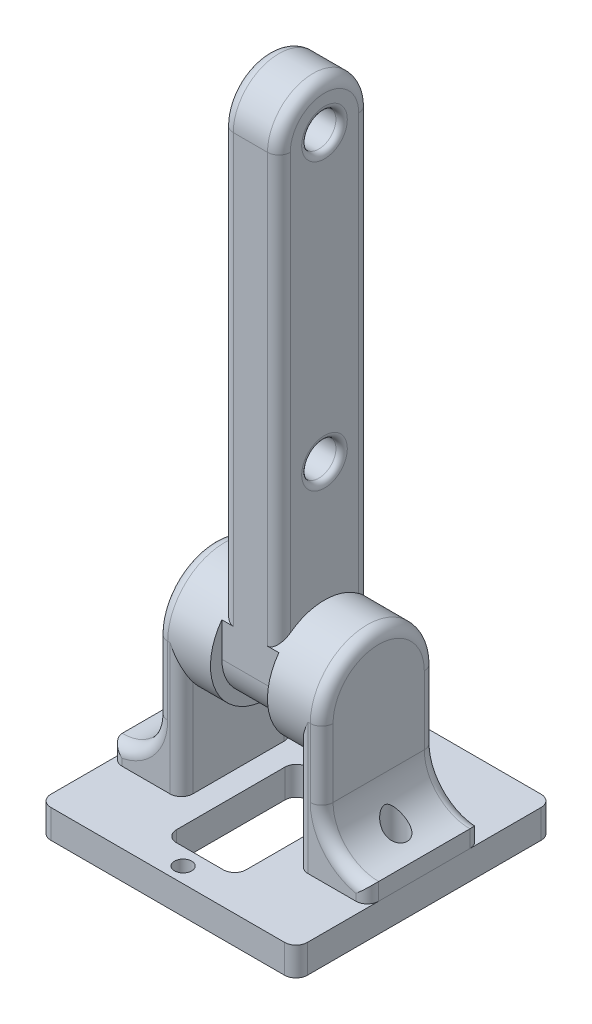
from build123d import *

# Parameters (mm, degrees)
CROQUIS1_W              = 45
CROQUIS1_H              = 45
CROQUIS1_R              = 2
CROQUIS1_R_2            = 1.5
CROQUIS1_W_2            = 12.2
CROQUIS1_H_2            = 23
SALIENTE_EXTRUIR1_DEPTH = 5
CORTAR_EXTRUIR1_START   = -2
CROQUIS2_R              = 2
CROQUIS2_R_2            = 1.5
CORTAR_EXTRUIR1_DEPTH   = 2
CROQUIS3_R              = 3
SALIENTE_EXTRUIR2_DEPTH = 5
SALIENTE_EXTRUIR4_DEPTH = 20
CORTAR_EXTRUIR2_START   = 10
CROQUIS4_R              = 2
CORTAR_EXTRUIR2_DEPTH   = 10
CROQUIS6_R              = 10
SALIENTE_EXTRUIR5_DEPTH = 9.5
REDONDEO3_R             = 2
REDONDEO4_R             = 1
REDONDEO5_R             = 2


with BuildPart() as part:
    # Croquis1 → Saliente-Extruir1 (new body)
    with BuildSketch(Plane(origin=(0, 0, 0), x_dir=(1, 0, 0), z_dir=(0, 1, 0))):
        with Locations((0, 5.35)):
            Rectangle(CROQUIS1_W, CROQUIS1_H)
        with Locations(Location((-17.5, 5.35, 0), (0, 0, 270))):
            Circle(CROQUIS1_R, mode=Mode.SUBTRACT)
        with Locations(Location((17.5, 5.35, 0), (0, 0, 270))):
            Circle(CROQUIS1_R, mode=Mode.SUBTRACT)
        with Locations(Location((0, 14.45, 0), (0, 0, 270))):
            Circle(CROQUIS1_R_2, mode=Mode.SUBTRACT)
        with Locations(Location((0, -14.45, 0), (0, 0, 270))):
            Circle(CROQUIS1_R_2, mode=Mode.SUBTRACT)
        Rectangle(CROQUIS1_W_2, CROQUIS1_H_2, mode=Mode.SUBTRACT)
    extrude(amount=-SALIENTE_EXTRUIR1_DEPTH)

    # Croquis2 → Cortar-Extruir1 (cut)
    # profile 1 of 2: a face of its own
    with BuildSketch(Plane.XZ.offset(5).offset(CORTAR_EXTRUIR1_START)):
        with Locations(Location((0, -14.45, 0), (0, 0, 270))):
            Circle(CROQUIS2_R)
        with Locations(Location((0, -14.45, 0), (0, 0, 90))):
            Circle(CROQUIS2_R_2, mode=Mode.SUBTRACT)
    # profile 2 of 2: a face of its own
    with BuildSketch(Plane.XZ.offset(5).offset(CORTAR_EXTRUIR1_START)):
        with Locations(Location((0, 14.45, 0), (0, 0, 270))):
            Circle(CROQUIS2_R)
        with Locations(Location((0, 14.45, 0), (0, 0, 90))):
            Circle(CROQUIS2_R_2, mode=Mode.SUBTRACT)
    extrude(amount=CORTAR_EXTRUIR1_DEPTH, mode=Mode.SUBTRACT)

    # Redondeo3
    redondeo3_edges = [part.edges().sort_by_distance(p)[0] for p in [
        (-22.5, -2.5, 17.15),
        (-22.5, -2.5, -27.85),
        (22.5, -2.5, -27.85),
        (22.5, -2.5, 17.15),
        (6.1, -2.5, -11.5),
        (-6.1, -2.5, -11.5),
        (-6.1, -2.5, 11.5),
        (6.1, -2.5, 11.5),
    ]]
    fillet(redondeo3_edges, radius=REDONDEO3_R)


with BuildPart() as body_2:
    # Croquis3 → Saliente-Extruir2 (new, symmetric)
    with BuildSketch(Plane(origin=(0, 0, 0), x_dir=(0, 0, -1), z_dir=(1, 0, 0))):
        with BuildLine():
            Line((-2.65, 104), (-2.65, 23))
            ThreePointArc((-2.65, 23), (5.35, 15), (13.35, 23))
            Line((13.35, 23), (13.35, 104))
            ThreePointArc((13.35, 104), (5.35, 112), (-2.65, 104))
        make_face()
        with Locations((5.35, 54)):
            Circle(CROQUIS3_R, mode=Mode.SUBTRACT)
        with Locations((5.35, 104)):
            Circle(CROQUIS3_R, mode=Mode.SUBTRACT)
    extrude(amount=SALIENTE_EXTRUIR2_DEPTH, both=True)

    # Redondeo4
    redondeo4_edges = [body_2.edges().sort_by_distance(p)[0] for p in [
        (5, 104, -2.35),
        (5, 54, -2.35),
        (-5, 54, -2.35),
        (-5, 104, -2.35),
    ]]
    fillet(redondeo4_edges, radius=REDONDEO4_R)


with BuildPart() as body_3:
    # Croquis5 → Saliente-Extruir4 (new body)
    with BuildSketch(Plane.XY.offset(4.65)):
        with BuildLine():
            Line((10.1, 23), (10.1, 0))
            Line((10.1, 0), (22.5, 0))
            Line((22.5, 0), (22.5, 3))
            ThreePointArc((22.5, 3), (16.843145751, 5.343145751), (14.5, 11))
            Line((14.5, 11), (14.5, 23))
            Line((14.5, 23), (10.1, 23))
        make_face()
    extrude(amount=-SALIENTE_EXTRUIR4_DEPTH)

    # Croquis4 → Cortar-Extruir2 (cut)
    with BuildSketch(Plane(origin=(0, 0, 0), x_dir=(1, 0, 0), z_dir=(0, 1, 0)).offset(CORTAR_EXTRUIR2_START)):
        with Locations(Location((17.5, 5.35, 0), (0, 0, 270))):
            Circle(CROQUIS4_R)
    extrude(amount=-CORTAR_EXTRUIR2_DEPTH, mode=Mode.SUBTRACT)

    # Croquis6 → Saliente-Extruir5 (add)
    with BuildSketch(Plane(origin=(14.5, 0, 0), x_dir=(0, 0, -1), z_dir=(1, 0, 0))):
        with Locations((5.35, 23)):
            Circle(CROQUIS6_R)
    extrude(amount=-SALIENTE_EXTRUIR5_DEPTH)


with BuildPart() as body_4:
    # Simetría3: mirrored copy
    add(body_3.part.mirror(Plane(origin=(0, 0, 0), x_dir=(0, 0, 1), z_dir=(1, 0, 0))))


with BuildPart() as body_2_1:
    add(body_2.part)

    # Combinar2: union body 4, body 3
    add(body_4.part)
    add(body_3.part)

    # Redondeo5
    # the kernel refuses this fillet: 2 mm, written as the material it takes off along each edge
    with BuildSketch(Plane(origin=(-5, 104, 2.65), x_dir=(1, 0, 0), z_dir=(0, -1, 0))) as redondeo5_piece_1_section:
        with BuildLine():
            CenterArc((REDONDEO5_R, -REDONDEO5_R), REDONDEO5_R, 90, 90)
            Line((0, -REDONDEO5_R), (0, 0))
            Line((0, 0), (REDONDEO5_R, 0))
        make_face()
    redondeo5_piece_1 = extrude(amount=80, mode=Mode.PRIVATE)
    redondeo5_piece_1 = redondeo5_piece_1 - Plane(origin=(-4.548383472, 23, -5.35), x_dir=(0, 0, -1), z_dir=(-1, 0, 0)) * Cylinder(10, 168, mode=Mode.PRIVATE)
    add(redondeo5_piece_1, mode=Mode.SUBTRACT)
    with BuildSketch(Plane(origin=(-5, 104, -5.35), x_dir=(0, 0, -1), z_dir=(0, -1, 0))) as redondeo5_piece_2:
        with BuildLine():
            CenterArc((8 - REDONDEO5_R, REDONDEO5_R), REDONDEO5_R, 270, 90)
            Line((8 - REDONDEO5_R, 0), (8, 0))
            Line((8, 0), (8, REDONDEO5_R))
        make_face()
    revolve(axis=Axis((-5, 104, -5.35), (1, 0, 0)), revolution_arc=180, mode=Mode.SUBTRACT)
    with BuildSketch(Plane(origin=(-5, 24, -13.35), x_dir=(1, 0, 0), z_dir=(0, 1, 0))) as redondeo5_piece_3_section:
        with BuildLine():
            CenterArc((REDONDEO5_R, -REDONDEO5_R), REDONDEO5_R, 90, 90)
            Line((0, -REDONDEO5_R), (0, 0))
            Line((0, 0), (REDONDEO5_R, 0))
        make_face()
    redondeo5_piece_3 = extrude(amount=80, mode=Mode.PRIVATE)
    redondeo5_piece_3 = redondeo5_piece_3 - Plane(origin=(-4.548386177, 23, -5.35), x_dir=(0, 0, -1), z_dir=(-1, 0, 0)) * Cylinder(10, 169, mode=Mode.PRIVATE)
    add(redondeo5_piece_3, mode=Mode.SUBTRACT)
    with BuildSketch(Plane(origin=(5, 104, -5.35), x_dir=(0, 0, -1), z_dir=(0, -1, 0))) as redondeo5_piece_4:
        with BuildLine():
            CenterArc((8 - REDONDEO5_R, -REDONDEO5_R), REDONDEO5_R, 0, 90)
            Line((8, -REDONDEO5_R), (8, 0))
            Line((8, 0), (8 - REDONDEO5_R, 0))
        make_face()
    revolve(axis=Axis((5, 104, -5.35), (1, 0, 0)), revolution_arc=180, mode=Mode.SUBTRACT)
    with BuildSketch(Plane(origin=(5, 104, 2.65), x_dir=(0, 0, -1), z_dir=(0, -1, 0))) as redondeo5_piece_5_section:
        with BuildLine():
            CenterArc((REDONDEO5_R, -REDONDEO5_R), REDONDEO5_R, 90, 90)
            Line((0, -REDONDEO5_R), (0, 0))
            Line((0, 0), (REDONDEO5_R, 0))
        make_face()
    redondeo5_piece_5 = extrude(amount=80, mode=Mode.PRIVATE)
    redondeo5_piece_5 = redondeo5_piece_5 - Plane(origin=(4.66275863, 23, -5.35), x_dir=(0, 0, -1), z_dir=(1, 0, 0)) * Cylinder(10, 168, mode=Mode.PRIVATE)
    add(redondeo5_piece_5, mode=Mode.SUBTRACT)
    with BuildSketch(Plane(origin=(-22.5, 11, 4.65), x_dir=(-0.5853008610590872, -0.810816194981015, 0), z_dir=(-0.810816194981015, 0.5853008610590872, 0))) as redondeo5_piece_6:
        with BuildLine():
            CenterArc((8 + REDONDEO5_R, -REDONDEO5_R), REDONDEO5_R, 90, 90)
            Line((8, -REDONDEO5_R), (8, 0))
            Line((8, 0), (8 + REDONDEO5_R, 0))
        make_face()
    revolve(axis=Axis((-22.5, 11, 4.65), (0, 0, 1)), revolution_arc=125.824247309, mode=Mode.SUBTRACT)
    with BuildSketch(Plane(origin=(-10.1, 28, -15.35), x_dir=(0, 0, 1), z_dir=(0, -1, 0))) as redondeo5_piece_7_section:
        with BuildLine():
            CenterArc((REDONDEO5_R, REDONDEO5_R), REDONDEO5_R, 180, 90)
            Line((0, REDONDEO5_R), (0, 0))
            Line((0, 0), (REDONDEO5_R, 0))
        make_face()
    redondeo5_piece_7 = extrude(amount=33, mode=Mode.PRIVATE)
    redondeo5_piece_7 = redondeo5_piece_7 - Plane(origin=(-10.561089915, 23, -5.35), x_dir=(0, 0, -1), z_dir=(-1, 0, 0)) * Cylinder(10, 74, mode=Mode.PRIVATE)
    add(redondeo5_piece_7, mode=Mode.SUBTRACT)
    with BuildSketch(Plane(origin=(-14.5, 11, 4.65), x_dir=(0, 0, -1), z_dir=(0, 1, 0)), Plane(origin=(14.5, 11, -15.35), x_dir=(0, 0, 1), z_dir=(0, 1, 0))) as redondeo5_piece_8:
        with BuildLine():
            CenterArc((REDONDEO5_R, -REDONDEO5_R), REDONDEO5_R, 90, 90)
            Line((0, -REDONDEO5_R), (0, 0))
            Line((0, 0), (REDONDEO5_R, 0))
        make_face()
    extrude(amount=12, mode=Mode.SUBTRACT)
    with BuildSketch(Plane(origin=(-22.5, -5, 4.65), x_dir=(1, 0, 0), z_dir=(0, 1, 0)), Plane(origin=(22.5, -5, -15.35), x_dir=(-1, 0, 0), z_dir=(0, 1, 0))) as redondeo5_piece_9:
        with BuildLine():
            CenterArc((REDONDEO5_R, REDONDEO5_R), REDONDEO5_R, 180, 90)
            Line((0, REDONDEO5_R), (0, 0))
            Line((0, 0), (REDONDEO5_R, 0))
        make_face()
    extrude(amount=13, mode=Mode.SUBTRACT)
    with BuildSketch(Plane(origin=(-22.5, -5, -15.35), x_dir=(1, 0, 0), z_dir=(0, 1, 0)), Plane(origin=(22.5, -5, 4.65), x_dir=(-1, 0, 0), z_dir=(0, 1, 0))) as redondeo5_piece_10:
        with BuildLine():
            CenterArc((REDONDEO5_R, -REDONDEO5_R), REDONDEO5_R, 90, 90)
            Line((0, -REDONDEO5_R), (0, 0))
            Line((0, 0), (REDONDEO5_R, 0))
        make_face()
    extrude(amount=13, mode=Mode.SUBTRACT)
    with BuildSketch(Plane(origin=(-22.5, 11, -15.35), x_dir=(-0.5853008610590872, -0.810816194981015, 0), z_dir=(-0.810816194981015, 0.5853008610590872, 0))) as redondeo5_piece_11:
        with BuildLine():
            CenterArc((8 + REDONDEO5_R, REDONDEO5_R), REDONDEO5_R, 180, 90)
            Line((8, REDONDEO5_R), (8, 0))
            Line((8, 0), (8 + REDONDEO5_R, 0))
        make_face()
    revolve(axis=Axis((-22.5, 11, -15.35), (0, 0, 1)), revolution_arc=125.824247309, mode=Mode.SUBTRACT)
    with BuildSketch(Plane(origin=(-14.5, 11, -15.35), x_dir=(0, 0, 1), z_dir=(0, 1, 0)), Plane(origin=(14.5, 11, 4.65), x_dir=(0, 0, -1), z_dir=(0, 1, 0))) as redondeo5_piece_12:
        with BuildLine():
            CenterArc((REDONDEO5_R, REDONDEO5_R), REDONDEO5_R, 180, 90)
            Line((0, REDONDEO5_R), (0, 0))
            Line((0, 0), (REDONDEO5_R, 0))
        make_face()
    extrude(amount=12, mode=Mode.SUBTRACT)
    with BuildSketch(Plane(origin=(-10.1, 28, 4.65), x_dir=(-1, 0, 0), z_dir=(0, -1, 0))) as redondeo5_piece_13_section:
        with BuildLine():
            CenterArc((REDONDEO5_R, REDONDEO5_R), REDONDEO5_R, 180, 90)
            Line((0, REDONDEO5_R), (0, 0))
            Line((0, 0), (REDONDEO5_R, 0))
        make_face()
    redondeo5_piece_13 = extrude(amount=33, mode=Mode.PRIVATE)
    redondeo5_piece_13 = redondeo5_piece_13 - Plane(origin=(-10.561089043, 23, -5.35), x_dir=(0, 0, -1), z_dir=(-1, 0, 0)) * Cylinder(10, 74, mode=Mode.PRIVATE)
    add(redondeo5_piece_13, mode=Mode.SUBTRACT)
    with BuildSketch(Plane(origin=(-14.5, 23, -5.35), x_dir=(0, 0, -1), z_dir=(0, -1, 0))) as redondeo5_piece_14:
        with BuildLine():
            CenterArc((10 - REDONDEO5_R, REDONDEO5_R), REDONDEO5_R, 270, 90)
            Line((10 - REDONDEO5_R, 0), (10, 0))
            Line((10, 0), (10, REDONDEO5_R))
        make_face()
    revolve(axis=Axis((-14.5, 23, -5.35), (1, 0, 0)), revolution_arc=180, mode=Mode.SUBTRACT)
    with BuildSketch(Plane(origin=(5, 24, -13.35), x_dir=(0, 0, 1), z_dir=(0, 1, 0))) as redondeo5_piece_15_section:
        with BuildLine():
            CenterArc((REDONDEO5_R, -REDONDEO5_R), REDONDEO5_R, 90, 90)
            Line((0, -REDONDEO5_R), (0, 0))
            Line((0, 0), (REDONDEO5_R, 0))
        make_face()
    redondeo5_piece_15 = extrude(amount=80, mode=Mode.PRIVATE)
    redondeo5_piece_15 = redondeo5_piece_15 - Plane(origin=(4.548386184, 23, -5.35), x_dir=(0, 0, -1), z_dir=(1, 0, 0)) * Cylinder(10, 169, mode=Mode.PRIVATE)
    add(redondeo5_piece_15, mode=Mode.SUBTRACT)
    with BuildSketch(Plane(origin=(22.5, 11, -15.35), x_dir=(0.5853008610590872, -0.810816194981015, 0), z_dir=(0.810816194981015, 0.5853008610590872, 0))) as redondeo5_piece_16:
        with BuildLine():
            CenterArc((8 + REDONDEO5_R, -REDONDEO5_R), REDONDEO5_R, 90, 90)
            Line((8, -REDONDEO5_R), (8, 0))
            Line((8, 0), (8 + REDONDEO5_R, 0))
        make_face()
    revolve(axis=Axis((22.5, 11, -15.35), (0, 0, -1)), revolution_arc=125.824247309, mode=Mode.SUBTRACT)
    with BuildSketch(Plane(origin=(10.1, 28, 4.65), x_dir=(1, 0, 0), z_dir=(0, -1, 0))) as redondeo5_piece_17_section:
        with BuildLine():
            CenterArc((REDONDEO5_R, -REDONDEO5_R), REDONDEO5_R, 90, 90)
            Line((0, -REDONDEO5_R), (0, 0))
            Line((0, 0), (REDONDEO5_R, 0))
        make_face()
    redondeo5_piece_17 = extrude(amount=33, mode=Mode.PRIVATE)
    redondeo5_piece_17 = redondeo5_piece_17 - Plane(origin=(10.561089043, 23, -5.35), x_dir=(0, 0, -1), z_dir=(1, 0, 0)) * Cylinder(10, 74, mode=Mode.PRIVATE)
    add(redondeo5_piece_17, mode=Mode.SUBTRACT)
    with BuildSketch(Plane(origin=(14.5, 23, -5.35), x_dir=(0, 0, -1), z_dir=(0, -1, 0))) as redondeo5_piece_18:
        with BuildLine():
            CenterArc((10 - REDONDEO5_R, -REDONDEO5_R), REDONDEO5_R, 0, 90)
            Line((10 - REDONDEO5_R, 0), (10, 0))
            Line((10, 0), (10, -REDONDEO5_R))
        make_face()
    revolve(axis=Axis((14.5, 23, -5.35), (1, 0, 0)), revolution_arc=180, mode=Mode.SUBTRACT)
    with BuildSketch(Plane(origin=(10.1, 28, -15.35), x_dir=(0, 0, 1), z_dir=(0, -1, 0))) as redondeo5_piece_19_section:
        with BuildLine():
            CenterArc((REDONDEO5_R, -REDONDEO5_R), REDONDEO5_R, 90, 90)
            Line((0, -REDONDEO5_R), (0, 0))
            Line((0, 0), (REDONDEO5_R, 0))
        make_face()
    redondeo5_piece_19 = extrude(amount=33, mode=Mode.PRIVATE)
    redondeo5_piece_19 = redondeo5_piece_19 - Plane(origin=(10.561089915, 23, -5.35), x_dir=(0, 0, -1), z_dir=(1, 0, 0)) * Cylinder(10, 74, mode=Mode.PRIVATE)
    add(redondeo5_piece_19, mode=Mode.SUBTRACT)
    with BuildSketch(Plane(origin=(22.5, 11, 4.65), x_dir=(0.5853008610590872, -0.810816194981015, 0), z_dir=(0.810816194981015, 0.5853008610590872, 0))) as redondeo5_piece_20:
        with BuildLine():
            CenterArc((8 + REDONDEO5_R, REDONDEO5_R), REDONDEO5_R, 180, 90)
            Line((8, REDONDEO5_R), (8, 0))
            Line((8, 0), (8 + REDONDEO5_R, 0))
        make_face()
    revolve(axis=Axis((22.5, 11, 4.65), (0, 0, -1)), revolution_arc=125.824247309, mode=Mode.SUBTRACT)


solid = Compound([part.part, body_2_1.part])
